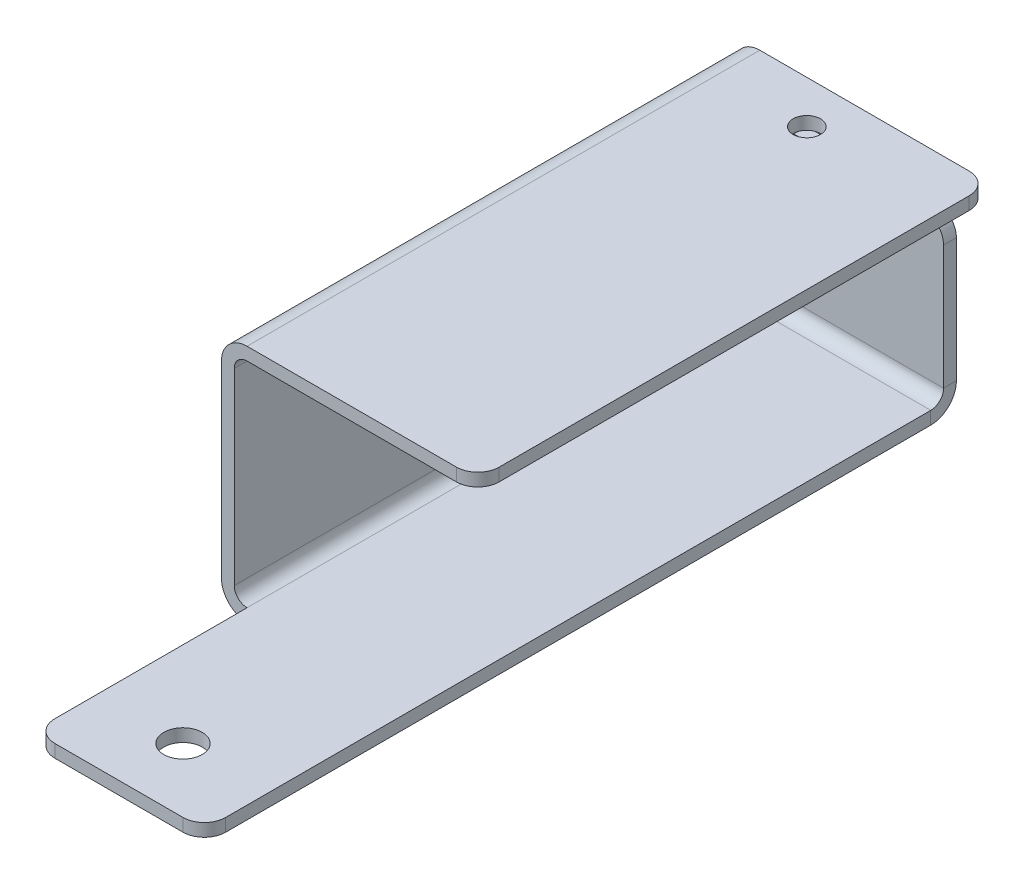
from build123d import *

# Parameters (mm, degrees)
SKETCH1_W                    = 20
SKETCH1_H                    = 85
BASE_FLANGE1_DEPTH           = 1.5
EDGE_FLANGE1_DEPTH           = 85
EDGE_FLANGE2_STRIP_W         = 9
EDGE_FLANGE2_STRIP_H         = 1.5
EDGE_FLANGE2_STRIP_CUT_DEPTH = 85
EDGE_FLANGE2_DEPTH           = 85
CUT_EXTRUDE1_DEPTH           = 53.891398166
CUT_EXTRUDE1_DEPTH_BACK      = 53.891398166
SKETCH13_W                   = 25
SKETCH13_H                   = 26.5
CUT_EXTRUDE2_DEPTH           = 53.891398166
CUT_EXTRUDE2_DEPTH_BACK      = 53.891398166
SKETCH14_W                   = 2.598076211
SKETCH14_H                   = 25
SKETCH15_R                   = 2.25
CAGE_MOUNTING_HOLE_DEPTH     = 53.891398166
EDGE_FLANGE3_DEPTH           = 20
ARDUINO_MOUNTING_HOLE_REACH  = 58.065
SKETCH19_R                   = 1.6
FILLET1_R                    = 2.5


# Sheet-metal steps are written as plain solids
with BuildPart() as part:
    # Sketch1 → Base-Flange1 (new body)
    with BuildSketch(Plane(origin=(0, 0, 0), x_dir=(1, 0, 0), z_dir=(0, 1, 0))):
        Rectangle(SKETCH1_W, SKETCH1_H)
    extrude(amount=-BASE_FLANGE1_DEPTH)

    # Edge-Flange1 section (across the edge) → Edge-Flange1 (add)
    with BuildSketch(Plane(origin=(-11.5, 0, -42.5), x_dir=(1, 0, 0), z_dir=(0, 0, 1))):
        with BuildLine():
            Line((-1.5, 1.5), (-1.5, 25))
            Line((-1.5, 25), (0, 25))
            Line((0, 25), (0, 1.5))
            ThreePointArc((0, 1.5), (0.439339828, 0.439339828), (1.5, 0))
            Line((1.5, 0), (1.5, -1.5))
            ThreePointArc((1.5, -1.5), (-0.621320344, -0.621320344), (-1.5, 1.5))
        make_face()
    extrude(amount=EDGE_FLANGE1_DEPTH)

    # Edge-Flange2 strip (across the edge) → Edge-Flange2 strip cut (cut)
    with BuildSketch(Plane(origin=(-11.5, 25, -42.5), x_dir=(0, -1, 0), z_dir=(0, 0, 1))):
        with Locations((-3, -0.75)):
            Rectangle(EDGE_FLANGE2_STRIP_W, EDGE_FLANGE2_STRIP_H)
    extrude(amount=EDGE_FLANGE2_STRIP_CUT_DEPTH, mode=Mode.SUBTRACT)

    # Edge-Flange2 section (across the edge) → Edge-Flange2 (add)
    with BuildSketch(Plane(origin=(-11.5, 25, -42.5), x_dir=(0, -1, 0), z_dir=(0, 0, 1))):
        with BuildLine():
            Line((-1.5, 1.5), (-1.5, 28.5))
            Line((-1.5, 28.5), (0, 28.5))
            Line((0, 28.5), (0, 1.5))
            ThreePointArc((0, 1.5), (0.439339828, 0.439339828), (1.5, 0))
            Line((1.5, 0), (1.5, -1.5))
            ThreePointArc((1.5, -1.5), (-0.621320344, -0.621320344), (-1.5, 1.5))
        make_face()
    extrude(amount=EDGE_FLANGE2_DEPTH)

    # Sketch13 → Cut-Extrude1 (cut, two sides: drawn at the far end of the back side and taken through both)
    with BuildSketch(Plane(origin=(0, 0, 0), x_dir=(0, 0, -1), z_dir=(1, 0, 0)).offset(-CUT_EXTRUDE1_DEPTH_BACK)):
        with Locations((-30, 13.25)):
            Rectangle(SKETCH13_W, SKETCH13_H)
    extrude(amount=CUT_EXTRUDE1_DEPTH + CUT_EXTRUDE1_DEPTH_BACK, mode=Mode.SUBTRACT)

    # Sketch14 → Cut-Extrude2 (cut, two sides: drawn at the far end of the back side and taken through both)
    with BuildSketch(Plane(origin=(0, 0, 0), x_dir=(1, 0, 0), z_dir=(0, 1, 0)).offset(-CUT_EXTRUDE2_DEPTH_BACK)):
        with Locations((-11.299038105, -30)):
            Rectangle(SKETCH14_W, SKETCH14_H)
    extrude(amount=CUT_EXTRUDE2_DEPTH + CUT_EXTRUDE2_DEPTH_BACK, mode=Mode.SUBTRACT)

    # Sketch15 → cage mounting hole (cut, through all)
    with BuildSketch(Plane(origin=(0, 0, 0), x_dir=(1, 0, 0), z_dir=(0, 1, 0))):
        with Locations(Location((0, -35, 0), (0, 0, 270))):
            Circle(SKETCH15_R)
    extrude(amount=-CAGE_MOUNTING_HOLE_DEPTH, mode=Mode.SUBTRACT)

    # Edge-Flange3 section (across the edge) → Edge-Flange3 (add)
    with BuildSketch(Plane(origin=(10, 0, -44), x_dir=(0, 0, 1), z_dir=(-1, 0, 0))):
        with BuildLine():
            Line((-1.5, 1.5), (-1.5, 18.5))
            Line((-1.5, 18.5), (0, 18.5))
            Line((0, 18.5), (0, 1.5))
            ThreePointArc((0, 1.5), (0.439339828, 0.439339828), (1.5, 0))
            Line((1.5, 0), (1.5, -1.5))
            ThreePointArc((1.5, -1.5), (-0.621320344, -0.621320344), (-1.5, 1.5))
        make_face()
    extrude(amount=EDGE_FLANGE3_DEPTH)

    # Sketch19 → arduino mounting hole (cut, up to next)
    with BuildSketch(Plane(origin=(0, 26.5, 0), x_dir=(1, 0, 0), z_dir=(0, 1, 0)), mode=Mode.PRIVATE) as arduino_mounting_hole_sk1:
        with Locations(Location((0.5, 37.5, 0), (0, 0, 180))):
            Circle(SKETCH19_R)
    arduino_mounting_hole_tool1 = extrude(arduino_mounting_hole_sk1.sketch, amount=-ARDUINO_MOUNTING_HOLE_REACH, mode=Mode.PRIVATE) & part.part
    add(arduino_mounting_hole_tool1.solids().sort_by_distance((0.5, 26.5, -37.5))[0], mode=Mode.SUBTRACT)

    # Fillet1
    fillet1_edges = [part.edges().sort_by_distance(p)[0] for p in [
        (10, 18.5, -44.75),
        (-10, 18.5, -44.75),
        (17, 25.75, -42.5),
        (17, 25.75, 17.5),
        (10, -0.75, 42.5),
        (-10, -0.75, 42.5),
    ]]
    fillet(fillet1_edges, radius=FILLET1_R)


solid = part.part
